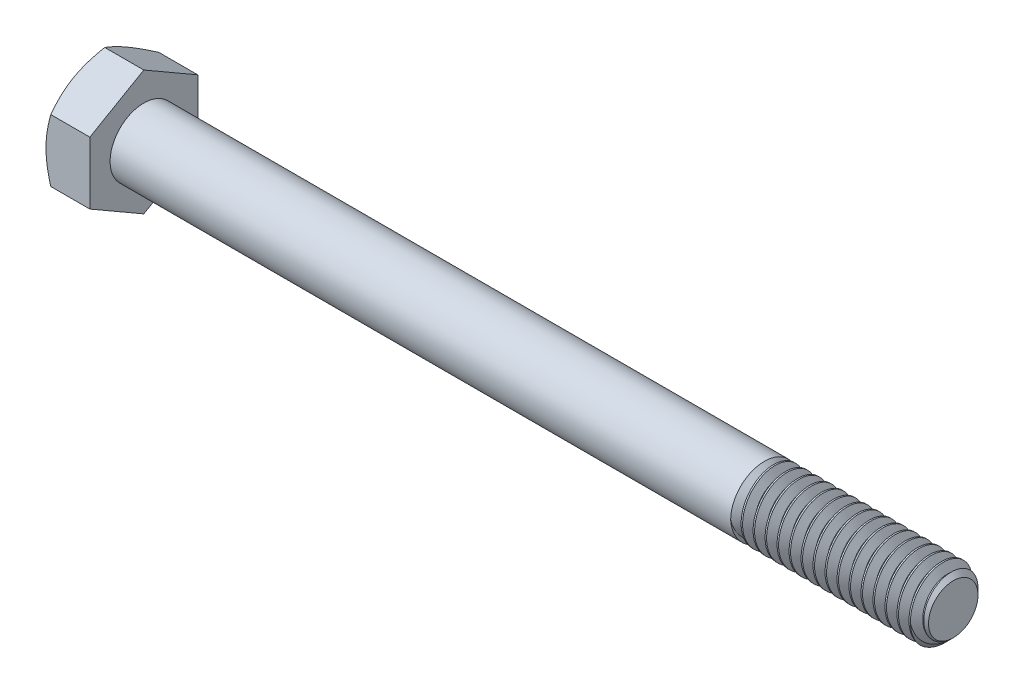
from build123d import *

# Parameters (mm, degrees)
SKETCH5_R           = 3.96875
BOSS_EXTRUDE3_DEPTH = 95.25
CHAMFER1_SIZE       = 1.058333333
CUT_SWEEP1_PITCH    = 1.411111111
BOSS_EXTRUDE4_DEPTH = 5.159375
SKETCH8_OUTSIDE_W   = 388.064
SKETCH8_OUTSIDE_H   = 390.028
SKETCH8_OUTSIDE_R   = 6.35
CUT_EXTRUDE3_DEPTH  = 101.87679833
CUT_EXTRUDE3_DRAFT  = -60
CUT_EXTRUDE4_DEPTH  = 0.254
CIRPATTERN1_COUNT   = 3


with BuildPart() as part:
    # Sketch5 → Boss-Extrude3 (new body)
    with BuildSketch(Plane(origin=(50.2046875, 0, 0), x_dir=(0, 0, -1), z_dir=(1, 0, 0))):
        Circle(SKETCH5_R)
    extrude(amount=-BOSS_EXTRUDE3_DEPTH)

    # Chamfer1
    chamfer1_edges = [part.edges().sort_by_distance(p)[0] for p in [
        (50.2046875, 0, 3.96875),
    ]]
    chamfer(chamfer1_edges, length=CHAMFER1_SIZE)

    # Cut-Sweep1: the profile of Sketch10 profile screwed along a right-hand helix of 16.75 turns, 8 arcs to a turn; built about Z, then put on its axis
    cut_sweep1_z = Axis((0, 0, 0), (0, 0, 1))
    cut_sweep1_corners = [(3.96905, 0, 0.000173205), (3.052206448, 0, -0.529166667), (3.052206448, 0, -0.705555556), (3.96905, 0, -1.234895427)]
    with BuildLine(mode=Mode.PRIVATE) as cut_sweep1_profile:
        Line(cut_sweep1_corners[0], cut_sweep1_corners[1])
        Line(cut_sweep1_corners[1], cut_sweep1_corners[2])
        Line(cut_sweep1_corners[2], cut_sweep1_corners[3])
        Line(cut_sweep1_corners[3], cut_sweep1_corners[0])
    cut_sweep1_cap = Face(cut_sweep1_profile.wire())
    cut_sweep1_turn_angles = [0, 22.5, 45, 67.5, 90, 112.5, 135, 157.5, 180, 202.5, 225, 247.5, 270, 292.5, 315, 337.5, 360]
    cut_sweep1_turn_weights = [1, 0.9238795325112867, 1, 0.9238795325112867, 1, 0.9238795325112867, 1, 0.9238795325112867, 1, 0.9238795325112867, 1, 0.9238795325112867, 1, 0.9238795325112867, 1, 0.9238795325112867, 1]
    cut_sweep1_turn_rails = [Edge.make_bspline([Vector(p[0], p[1], 0).rotate(cut_sweep1_z, cut_sweep1_turn_angles[k]) / cut_sweep1_turn_weights[k] + Vector(0, 0, p[2] + CUT_SWEEP1_PITCH * cut_sweep1_turn_angles[k] / 360) for k in range(17)], [0, 0, 0, 1, 1, 2, 2, 3, 3, 4, 4, 5, 5, 6, 6, 7, 7, 8, 8, 8], 2, cut_sweep1_turn_weights) for p in cut_sweep1_corners]
    cut_sweep1_turn_sides = [Face.make_surface_from_curves(cut_sweep1_turn_rails[p[0]], cut_sweep1_turn_rails[p[1]]) for p in [(0, 1), (1, 2), (2, 3), (3, 0)]]
    cut_sweep1_last_angles = [5760, 5782.5, 5805, 5827.5, 5850, 5872.5, 5895, 5917.5, 5940, 5962.5, 5985, 6007.5, 6030]
    cut_sweep1_last_weights = [1, 0.9238795325112867, 1, 0.9238795325112867, 1, 0.9238795325112867, 1, 0.9238795325112867, 1, 0.9238795325112867, 1, 0.9238795325112473, 1]
    cut_sweep1_last_rails = [Edge.make_bspline([Vector(p[0], p[1], 0).rotate(cut_sweep1_z, cut_sweep1_last_angles[k]) / cut_sweep1_last_weights[k] + Vector(0, 0, p[2] + CUT_SWEEP1_PITCH * cut_sweep1_last_angles[k] / 360) for k in range(13)], [0, 0, 0, 1, 1, 2, 2, 3, 3, 4, 4, 5, 5, 6, 6, 6], 2, cut_sweep1_last_weights) for p in cut_sweep1_corners]
    cut_sweep1_last_sides = [Face.make_surface_from_curves(cut_sweep1_last_rails[p[0]], cut_sweep1_last_rails[p[1]]) for p in [(0, 1), (1, 2), (2, 3), (3, 0)]]
    cut_sweep1 = Plane(origin=(50.2046875, 0, 0), x_dir=(0, 1, 0), z_dir=(-1, 0, 0)) * Solid(Shell([*[p.moved(Location((0, 0, CUT_SWEEP1_PITCH * i))) for i in range(16) for p in cut_sweep1_turn_sides], *cut_sweep1_last_sides, cut_sweep1_cap, cut_sweep1_cap.rotate(cut_sweep1_z, 6030).moved(Location((0, 0, CUT_SWEEP1_PITCH * 6030 / 360)))]))
    add(cut_sweep1, mode=Mode.SUBTRACT)

    # Sketch11 → Revolve1 (revolve)
    with BuildSketch(Plane.XY, mode=Mode.PRIVATE) as revolve1_sk:
        Polygon((-45.0453125, 3.96875), (-45.0453125, 0), (31.9484375, 0), (27.9796875, 3.96875), align=None)
    revolve(revolve1_sk.sketch.rotate(Axis((-45.0453125, 0, 0), (1, 0, 0)), 270), axis=Axis((-45.0453125, 0, 0), (1, 0, 0)))

    # Sketch6 → Boss-Extrude4 (add)
    with BuildSketch(Plane.ZY.offset(45.0453125)):
        Polygon((6.35, 3.666174209), (0, 7.332348419), (-6.35, 3.666174209), (-6.35, -3.666174209), (0, -7.332348419), (6.35, -3.666174209), align=None)
    extrude(amount=BOSS_EXTRUDE4_DEPTH)


with BuildPart() as cut_extrude3_tool:
    # Sketch8 outside → Cut-Extrude3 (with draft: the straight prism first)
    with BuildSketch(Plane.ZY.offset(50.2046875)):
        Rectangle(SKETCH8_OUTSIDE_W, SKETCH8_OUTSIDE_H)
        Circle(SKETCH8_OUTSIDE_R, mode=Mode.SUBTRACT)
    extrude(amount=-CUT_EXTRUDE3_DEPTH)
    # Cut-Extrude3: the draft: its side faces are tilted about the plane it starts from
    cut_extrude3_sides = [cut_extrude3_tool.faces().sort_by_distance(p)[0] for p in [
        (0.733711665, -195.014, 0),
        (0.733711665, 0, 194.032),
        (0.733711665, 195.014, 0),
        (0.733711665, 0, -194.032),
        (0.733711665, 0, -6.35),
    ]]
    draft(cut_extrude3_sides, Plane.ZY.offset(50.2046875), CUT_EXTRUDE3_DRAFT)


with BuildPart() as part_1:
    add(part.part)

    # Cut-Extrude3: cut by cut_extrude3_tool
    add(cut_extrude3_tool.part, mode=Mode.SUBTRACT)

    # Sketch12 → Cut-Extrude4 (cut)
    with BuildSketch(Plane.ZY.offset(50.2046875)):
        with BuildLine():
            Line((0.1905, 4.8895), (0.1905, 2.7305))
            ThreePointArc((0.1905, 2.7305), (0, 2.54), (-0.1905, 2.7305))
            Line((-0.1905, 2.7305), (-0.1905, 4.8895))
            ThreePointArc((-0.1905, 4.8895), (0, 5.08), (0.1905, 4.8895))
        make_face()
    cut_extrude4 = extrude(amount=-CUT_EXTRUDE4_DEPTH, mode=Mode.SUBTRACT)

    # CirPattern1: Cut-Extrude4 ×3 about axis
    cirpattern1_axis = Axis((0, 0, 0), (1, 0, 0))
    for i in range(1, CIRPATTERN1_COUNT):
        add(cut_extrude4.rotate(cirpattern1_axis, i * 360 / CIRPATTERN1_COUNT), mode=Mode.SUBTRACT)


solid = part_1.part
